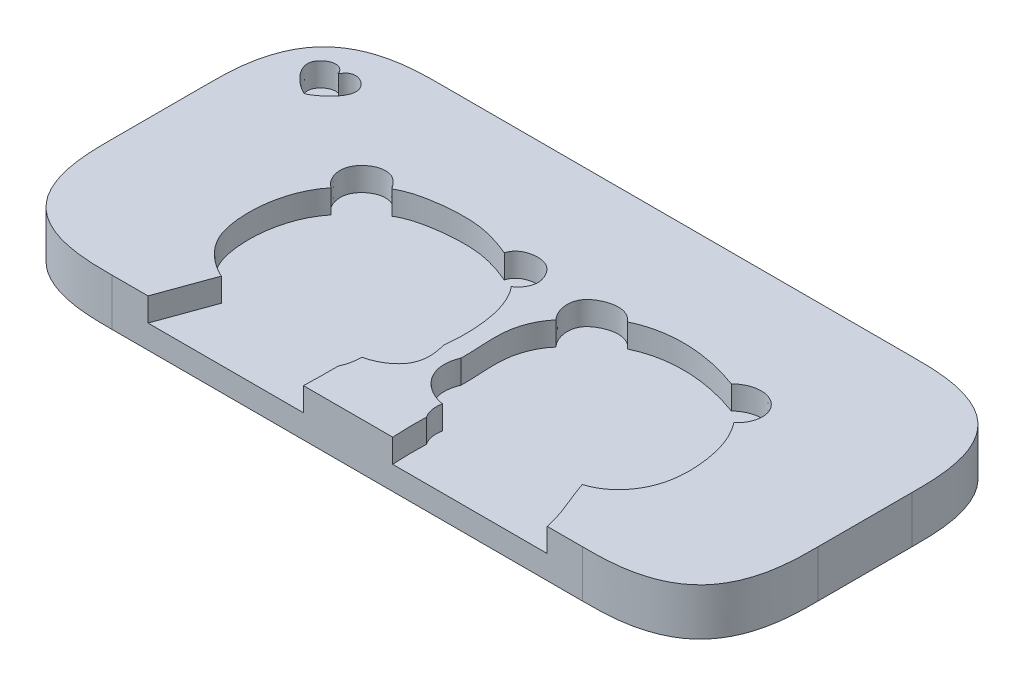
from build123d import *

# Parameters (mm, degrees)
SKETCH_1_W          = 60
SKETCH_1_H          = 28
EXTRUDE_1_DEPTH     = 4
FILLET_1_SIZE       = 10
CUT_EXTRUDE_1_DEPTH = 2


with BuildPart() as part:
    # 草图1 → 凸台-拉伸1 (new body)
    with BuildSketch(Plane(origin=(0, 0, 0), x_dir=(1, 0, 0), z_dir=(0, 1, 0))):
        Rectangle(SKETCH_1_W, SKETCH_1_H)
    extrude(amount=EXTRUDE_1_DEPTH)

    # 圆角1
    # a fillet whose section is not a circle: 10 mm, written as the material it takes off along each edge
    with BuildSketch(Plane(origin=(30, -25, 14), x_dir=(0, 0, -1), z_dir=(0, 1, 0)), Plane(origin=(30, -25, -14), x_dir=(-1, 0, 0), z_dir=(0, 1, 0)), Plane(origin=(-30, -25, 14), x_dir=(1, 0, 0), z_dir=(0, 1, 0))) as fillet_1_piece_1:
        with BuildLine():
            add(Edge.make_bspline([(FILLET_1_SIZE, 0), (FILLET_1_SIZE * 0.831801948466, 0), (FILLET_1_SIZE * 0.663603896932, 0), (FILLET_1_SIZE * 0.292893218813, FILLET_1_SIZE * 0.0716919198361), (FILLET_1_SIZE * 0.0716919198361, FILLET_1_SIZE * 0.292893218813), (0, FILLET_1_SIZE * 0.663603896932), (0, FILLET_1_SIZE * 0.831801948466), (0, FILLET_1_SIZE)], knots=[0, 0, 0, 0, 0, 0, 0.5, 0.5, 1, 1, 1, 1, 1, 1], degree=5))
            Line((0, FILLET_1_SIZE), (0, 0))
            Line((0, 0), (FILLET_1_SIZE, 0))
        make_face()
    extrude(amount=54, mode=Mode.SUBTRACT)
    with BuildSketch(Plane(origin=(-30, -25, -14), x_dir=(1, 0, 0), z_dir=(0, 1, 0))) as fillet_1_piece_2:
        with BuildLine():
            add(Edge.make_bspline([(FILLET_1_SIZE, 0), (FILLET_1_SIZE * 0.831801948466, 0), (FILLET_1_SIZE * 0.663603896932, 0), (FILLET_1_SIZE * 0.292893218813, -FILLET_1_SIZE * 0.0716919198361), (FILLET_1_SIZE * 0.0716919198361, -FILLET_1_SIZE * 0.292893218813), (0, -FILLET_1_SIZE * 0.663603896932), (0, -FILLET_1_SIZE * 0.831801948466), (0, -FILLET_1_SIZE)], knots=[0, 0, 0, 0, 0, 0, 0.5, 0.5, 1, 1, 1, 1, 1, 1], degree=5))
            Line((0, -FILLET_1_SIZE), (0, 0))
            Line((0, 0), (FILLET_1_SIZE, 0))
        make_face()
    extrude(amount=54, mode=Mode.SUBTRACT)

    # 草图2 → 切除-拉伸1 (cut)
    with BuildSketch(Plane(origin=(0, 4, 0), x_dir=(1, 0, 0), z_dir=(0, 1, 0))):
        with BuildLine():
            Line((-16.935076069, -14), (-3.724944257, -14))
            add(Edge.make_bspline(
                [(-3.687819463, -11.10018183), (-3.670837845, -12.550695913), (-3.724944257, -14)],
                knots=[0, 0, 0, 1, 1, 1], degree=2))
            add(Edge.make_bspline(
                [(-3.333312713, -9.429337618), (-3.330795543, -10.302670918), (-3.687819463, -11.10018183)],
                knots=[0, 0, 0, 1, 1, 1], degree=2))
            add(Edge.make_bspline(
                [(-0.742711054, -5.127809832), (-0.519156675, -5.880287043), (-0.292936969, -8.050568721), (-2.341442668, -9.22030854), (-3.333312713, -9.429337618)],
                knots=[0, 0, 0, 0, 0.428917256, 1, 1, 1, 1], degree=3))
            add(Edge.make_bspline(
                [(-2.187125143, 2.12230749), (-1.4106002, 1.204552618), (-0.592489001, -1.244047904), (-0.600668316, -3.791601167), (-0.742711054, -5.127809832)],
                knots=[0, 0, 0, 0, 0.466812094, 1, 1, 1, 1], degree=3))
            add(Edge.make_bspline(
                [(-4.963765819, 4.30996378), (-4.793040938, 4.977205844), (-3.75279166, 5.532669201), (-2.278151789, 5.341305653), (-1.531570873, 4.465738286), (-1.148751049, 3.242289174), (-1.743465674, 2.389914822), (-2.187125143, 2.12230749)],
                knots=[0, 0, 0, 0, 0.278653368, 0.467417998, 0.60771691, 0.765483941, 1, 1, 1, 1], degree=3))
            add(Edge.make_bspline(
                [(-14.443609745, 4.225823154), (-13.661769199, 4.701986871), (-12.07963713, 5.088608477), (-9.80873584, 5.325514917), (-7.438485821, 5.235768859), (-5.859496423, 4.683683956), (-4.963765819, 4.30996378)],
                knots=[0, 0, 0, 0, 0.277671681, 0.493980308, 0.700924653, 1, 1, 1, 1], degree=3))
            add(Edge.make_bspline(
                [(-17.112369797, 1.740167248), (-17.796876509, 2.159176308), (-18.361225861, 3.59646204), (-17.356865882, 4.881210301), (-16.40295998, 5.370009473), (-15.208277597, 5.256104096), (-14.685195355, 4.587656422), (-14.443609745, 4.225823154)],
                knots=[0, 0, 0, 0, 0.353240726, 0.517926677, 0.663976899, 0.804852125, 1, 1, 1, 1], degree=3))
            add(Edge.make_bspline(
                [(-15.280334608, -9.429337618), (-16.497678509, -8.866325433), (-18.294247529, -7.346930593), (-18.872884283, -4.315150537), (-18.745655148, -1.369033801), (-17.944096186, 0.728594057), (-17.112369797, 1.740167248)],
                knots=[0, 0, 0, 0, 0.318174296, 0.494604613, 0.698392994, 1, 1, 1, 1], degree=3))
            Line((-15.280334608, -9.429337618), (-16.935076069, -14))
        make_face()
        with BuildLine():
            Line((3.859545005, -14), (16.989453484, -14))
            add(Edge.make_bspline(
                [(15.404911602, -9.429337618), (15.900430103, -10.960211179), (16.69378742, -12.407476359), (16.989453484, -14)],
                knots=[0, 0, 0, 0, 1, 1, 1, 1], degree=3))
            add(Edge.make_bspline(
                [(17.288668554, 1.574170629), (18.287334611, 0.305452853), (19.081858131, -2.363427448), (18.899603104, -6.766539361), (16.920972519, -8.986056385), (15.404911602, -9.429337618)],
                knots=[0, 0, 0, 0, 0.370985391, 0.64043209, 1, 1, 1, 1], degree=3))
            add(Edge.make_bspline(
                [(14.333173858, 4.30996378), (14.813620622, 4.805305608), (15.919659705, 5.273598818), (17.423209254, 4.783697576), (18.393133704, 3.377287394), (17.886541605, 2.047965808), (17.288668554, 1.574170629)],
                knots=[0, 0, 0, 0, 0.305299637, 0.480890731, 0.659706763, 1, 1, 1, 1], degree=3))
            add(Edge.make_bspline(
                [(5.359934346, 4.464221596), (8.147654076, 5.822153518), (11.537691595, 5.354629666), (14.333173858, 4.30996378)],
                knots=[0, 0, 0, 0, 1, 1, 1, 1], degree=3))
            add(Edge.make_bspline(
                [(2.170811741, 1.574170629), (1.581087403, 2.132858214), (1.138470768, 3.878747123), (3.169357766, 5.317866652), (4.664971625, 5.28325304), (5.359934346, 4.464221596)],
                knots=[0, 0, 0, 0, 0.379311018, 0.599175154, 1, 1, 1, 1], degree=3))
            add(Edge.make_bspline(
                [(0.941523625, -5.262232932), (0.98567745, -3.887367548), (0.523188823, -1.466699515), (1.521155106, 0.830396312), (2.170811741, 1.574170629)],
                knots=[0, 0, 0, 0, 0.583806076, 1, 1, 1, 1], degree=3))
            add(Edge.make_bspline(
                [(3.524384204, -9.429337618), (2.557976333, -9.282877204), (1.192253003, -8.451499296), (0.573882177, -6.601892019), (0.759159881, -5.696024028), (0.941523625, -5.262232932)],
                knots=[0, 0, 0, 0, 0.526961764, 0.748177959, 1, 1, 1, 1], degree=3))
            add(Edge.make_bspline(
                [(3.821968614, -11.10018183), (3.337919448, -10.344678931), (3.524384204, -9.429337618)],
                knots=[0, 0, 0, 1, 1, 1], degree=2))
            add(Edge.make_bspline(
                [(3.859545005, -14), (3.769556535, -12.550344491), (3.821968614, -11.10018183)],
                knots=[0, 0, 0, 1, 1, 1], degree=2))
        make_face()
        with BuildLine():
            add(Edge.make_bspline(
                [(-25.185013425, 10.431735443), (-25.689297318, 11.557258243), (-28.770586094, 10.040399625), (-25.818873431, 7.748418433), (-25.185013425, 7.531774201)],
                knots=[0, 0, 0, 0, 0.419335828, 1, 1, 1, 1], degree=3))
            add(Edge.make_bspline(
                [(-25.185013425, 10.431735443), (-24.680729531, 11.557258243), (-21.599440755, 10.040399625), (-24.551153418, 7.748418433), (-25.185013425, 7.531774201)],
                knots=[0, 0, 0, 0, 0.419335828, 1, 1, 1, 1], degree=3))
        make_face()
    extrude(amount=-CUT_EXTRUDE_1_DEPTH, mode=Mode.SUBTRACT)


solid = part.part
